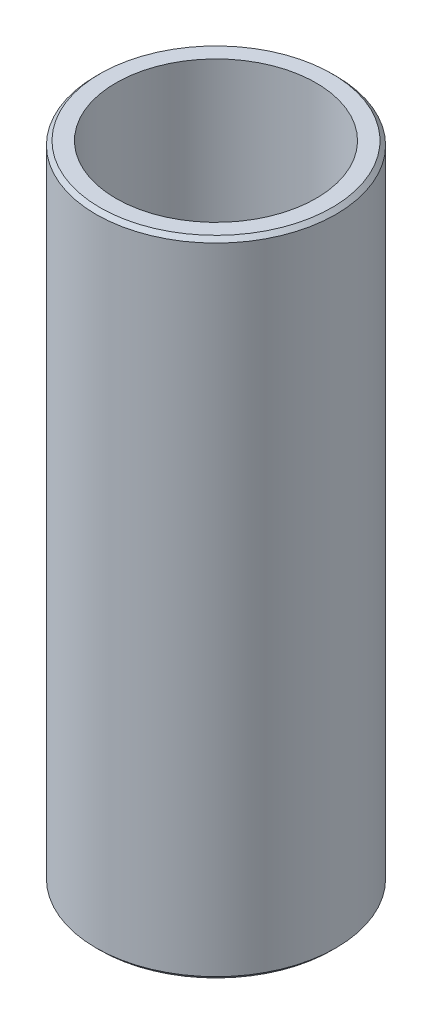
from build123d import *

# Parameters (mm, degrees)
SKETCH1_R           = 50
BOSS_EXTRUDE1_DEPTH = 268.144726717
SKETCH2_R           = 41.7348185
CUT_EXTRUDE1_DEPTH  = 278.311367358
CHAMFER1_SIZE       = 1.63950754


with BuildPart() as part:
    # Sketch1 → Boss-Extrude1 (new body)
    with BuildSketch(Plane(origin=(0, 0, 0), x_dir=(1, 0, 0), z_dir=(0, 1, 0))):
        Circle(SKETCH1_R)
    extrude(amount=BOSS_EXTRUDE1_DEPTH)

    # Sketch2 → Cut-Extrude1 (cut, through all)
    with BuildSketch(Plane(origin=(0, 0, 0), x_dir=(1, 0, 0), z_dir=(0, 1, 0))):
        Circle(SKETCH2_R)
    extrude(amount=CUT_EXTRUDE1_DEPTH, mode=Mode.SUBTRACT)

    # Chamfer1
    chamfer1_edges = [part.edges().sort_by_distance(p)[0] for p in [
        (-50, 268.144726717, 0),
        (-50, 0, 0),
    ]]
    chamfer(chamfer1_edges, length=CHAMFER1_SIZE)


solid = part.part
